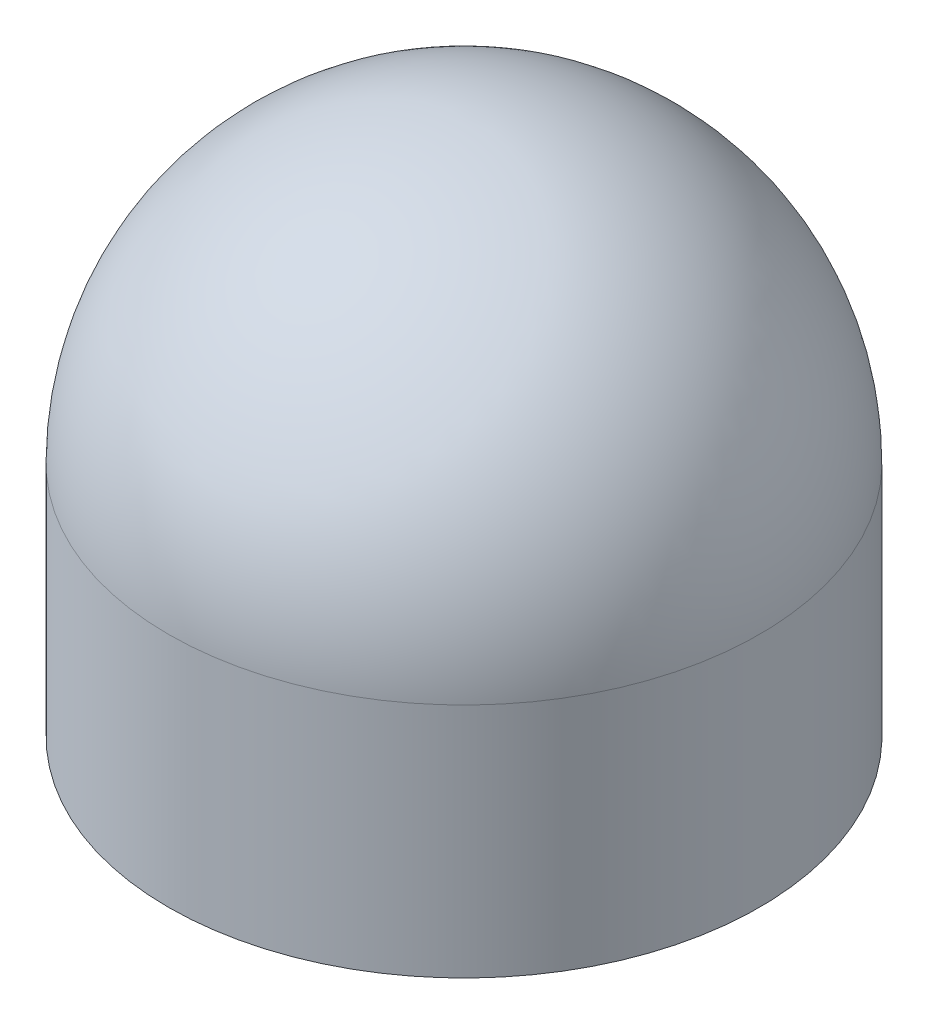
from build123d import *

# Parameters (mm, degrees)
SKETCH2_R           = 7.5
BOSS_EXTRUDE1_DEPTH = 13.5
SKETCH3_R           = 5
CUT_EXTRUDE1_DEPTH  = 5
FILLET1_R           = 7.5
THREAD1_PITCH       = 2
SKETCH10_W          = 14.918293933
SKETCH10_H          = 11.930208352
CUT_EXTRUDE2_DEPTH  = 5


with BuildPart() as part:
    # Sketch2 → Boss-Extrude1 (new body)
    with BuildSketch(Plane(origin=(0, 0, 0), x_dir=(1, 0, 0), z_dir=(0, 1, 0))):
        with Locations(Location((0, 0, 0), (0, 0, 270))):
            Circle(SKETCH2_R)
    extrude(amount=BOSS_EXTRUDE1_DEPTH)

    # Sketch3 → Cut-Extrude1 (cut)
    with BuildSketch(Plane(origin=(0, 0, 0), x_dir=(-1, 0, 0), z_dir=(0, -1, 0))):
        with Locations(Location((0, 0, 0), (0, 0, 90))):
            Circle(SKETCH3_R)
    extrude(amount=-CUT_EXTRUDE1_DEPTH, mode=Mode.SUBTRACT)

    # Fillet1
    fillet1_edges = [part.edges().sort_by_distance(p)[0] for p in [
        (0, 13.5, -7.5),
    ]]
    fillet(fillet1_edges, radius=FILLET1_R)

    # Thread1: the profile of Thread Profile2 profile screwed along a right-hand helix of 2.5 turns, 10 arcs to a turn; built about Z, then put on its axis
    thread1_z = Axis((0, 0, 0), (0, 0, 1))
    thread1_corners = [(5.0003, -1e-09, -0.000173205), (5.0003, -1e-09, 1.7501732), (3.91746825, -1e-09, 1.124999997), (3.91746825, -1e-09, 0.624999997)]
    with BuildLine(mode=Mode.PRIVATE) as thread1_profile:
        Line(thread1_corners[0], thread1_corners[1])
        Line(thread1_corners[1], thread1_corners[2])
        Line(thread1_corners[2], thread1_corners[3])
        Line(thread1_corners[3], thread1_corners[0])
    thread1_cap = Face(thread1_profile.wire())
    thread1_turn_angles = [0, 18, 36, 54, 72, 90, 108, 126, 144, 162, 180, 198, 216, 234, 252, 270, 288, 306, 324, 342, 360]
    thread1_turn_weights = [1, 0.9510565162951535, 1, 0.9510565162951535, 1, 0.9510565162951535, 1, 0.9510565162951535, 1, 0.9510565162951535, 1, 0.9510565162951535, 1, 0.9510565162951535, 1, 0.9510565162951535, 1, 0.9510565162951535, 1, 0.9510565162951535, 1]
    thread1_turn_rails = [Edge.make_bspline([Vector(p[0], p[1], 0).rotate(thread1_z, thread1_turn_angles[k]) / thread1_turn_weights[k] + Vector(0, 0, p[2] + THREAD1_PITCH * thread1_turn_angles[k] / 360) for k in range(21)], [0, 0, 0, 1, 1, 2, 2, 3, 3, 4, 4, 5, 5, 6, 6, 7, 7, 8, 8, 9, 9, 10, 10, 10], 2, thread1_turn_weights) for p in thread1_corners]
    thread1_turn_sides = [Face.make_surface_from_curves(thread1_turn_rails[p[0]], thread1_turn_rails[p[1]]) for p in [(0, 1), (1, 2), (2, 3), (3, 0)]]
    thread1_last_angles = [720, 738, 756, 774, 792, 810, 828, 846, 864, 882, 900]
    thread1_last_weights = [1, 0.9510565162951535, 1, 0.9510565162951535, 1, 0.9510565162951535, 1, 0.9510565162951535, 1, 0.9510565162951539, 1]
    thread1_last_rails = [Edge.make_bspline([Vector(p[0], p[1], 0).rotate(thread1_z, thread1_last_angles[k]) / thread1_last_weights[k] + Vector(0, 0, p[2] + THREAD1_PITCH * thread1_last_angles[k] / 360) for k in range(11)], [0, 0, 0, 1, 1, 2, 2, 3, 3, 4, 4, 5, 5, 5], 2, thread1_last_weights) for p in thread1_corners]
    thread1_last_sides = [Face.make_surface_from_curves(thread1_last_rails[p[0]], thread1_last_rails[p[1]]) for p in [(0, 1), (1, 2), (2, 3), (3, 0)]]
    thread1 = Plane(origin=(0, -1, 0), x_dir=(0.996194698, 0, -0.087155743), z_dir=(0, 1, 0)) * Solid(Shell([*[p.moved(Location((0, 0, THREAD1_PITCH * i))) for i in range(2) for p in thread1_turn_sides], *thread1_last_sides, thread1_cap, thread1_cap.rotate(thread1_z, 900).moved(Location((0, 0, THREAD1_PITCH * 900 / 360)))]))
    add(thread1)

    # Sketch10 → Cut-Extrude2 (cut)
    with BuildSketch(Plane(origin=(0, 0, 0), x_dir=(-1, 0, 0), z_dir=(0, -1, 0))):
        with Locations((1.239502166, -0.263539638)):
            Rectangle(SKETCH10_W, SKETCH10_H)
    extrude(amount=CUT_EXTRUDE2_DEPTH, mode=Mode.SUBTRACT)


solid = part.part
